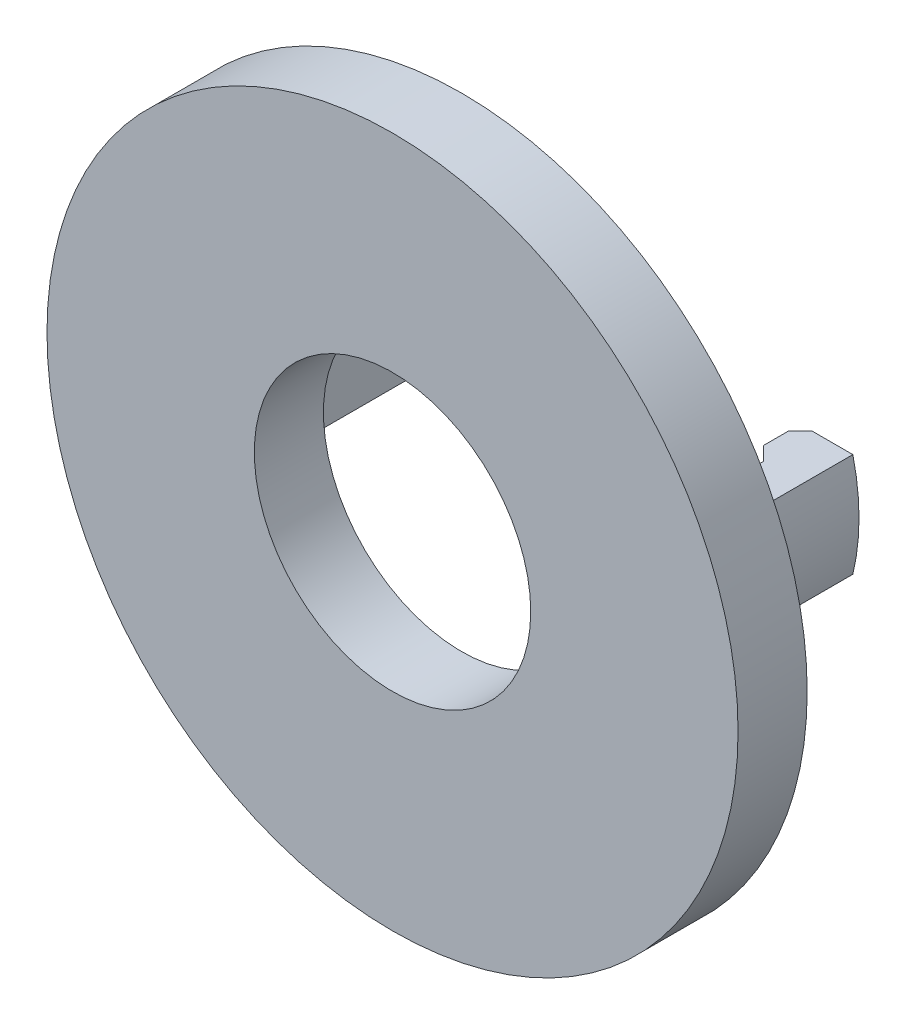
from build123d import *

# Parameters (mm, degrees)
GUARD_BASE_R           = 25
GUARD_DEPTH            = 5
INNER_AXLE_HOLE_BASE_R = 10
INNER_AXLE_HOLE_DEPTH  = 36.707142143
COUPLING_TOOTH_DEPTH   = 3.75
SKETCH6_4_W            = 9
SKETCH6_4_H            = 12.75


with BuildPart() as part:
    # Guard base → Guard (new body)
    with BuildSketch(Plane.XY):
        Circle(GUARD_BASE_R)
    extrude(amount=GUARD_DEPTH)

    # Inner axle hole base → Inner axle hole (cut, through all)
    with BuildSketch(Plane.XY.offset(5)):
        Circle(INNER_AXLE_HOLE_BASE_R)
    extrude(amount=-INNER_AXLE_HOLE_DEPTH, mode=Mode.SUBTRACT)

    # Coupling tooth base → Coupling tooth (add, symmetric)
    with BuildSketch(Plane(origin=(0, 0, 0), x_dir=(1, 0, 0), z_dir=(0, 1, 0))):
        Polygon((10.353553391, 0), (16, 0), (16, 12.75), (12.603553391, 12.75), (11.75, 11.896446609), (11.75, 10.103553391), (12.75, 9.103553391), (12.75, 2.396446609), align=None)
    coupling_tooth = extrude(amount=COUPLING_TOOTH_DEPTH, both=True)

    # Sketch6<4> → Circularity cut (revolve, cut)
    with BuildSketch(Plane(origin=(0, 0, 0), x_dir=(1, 0, 0), z_dir=(0, 1, 0))):
        with Locations((20.5, 6.375)):
            Rectangle(SKETCH6_4_W, SKETCH6_4_H)
    circularity_cut = revolve(axis=Axis((0, 0, 0), (0, 0, -1)), mode=Mode.SUBTRACT)

    # Coutpling teeth: Coupling tooth, Circularity cut across plane
    add(coupling_tooth.mirror(Plane(origin=(0, 0, 0), x_dir=(0, 0, 1), z_dir=(1, 0, 0))))
    add(circularity_cut.mirror(Plane(origin=(0, 0, 0), x_dir=(0, 0, 1), z_dir=(1, 0, 0))), mode=Mode.SUBTRACT)


solid = part.part
